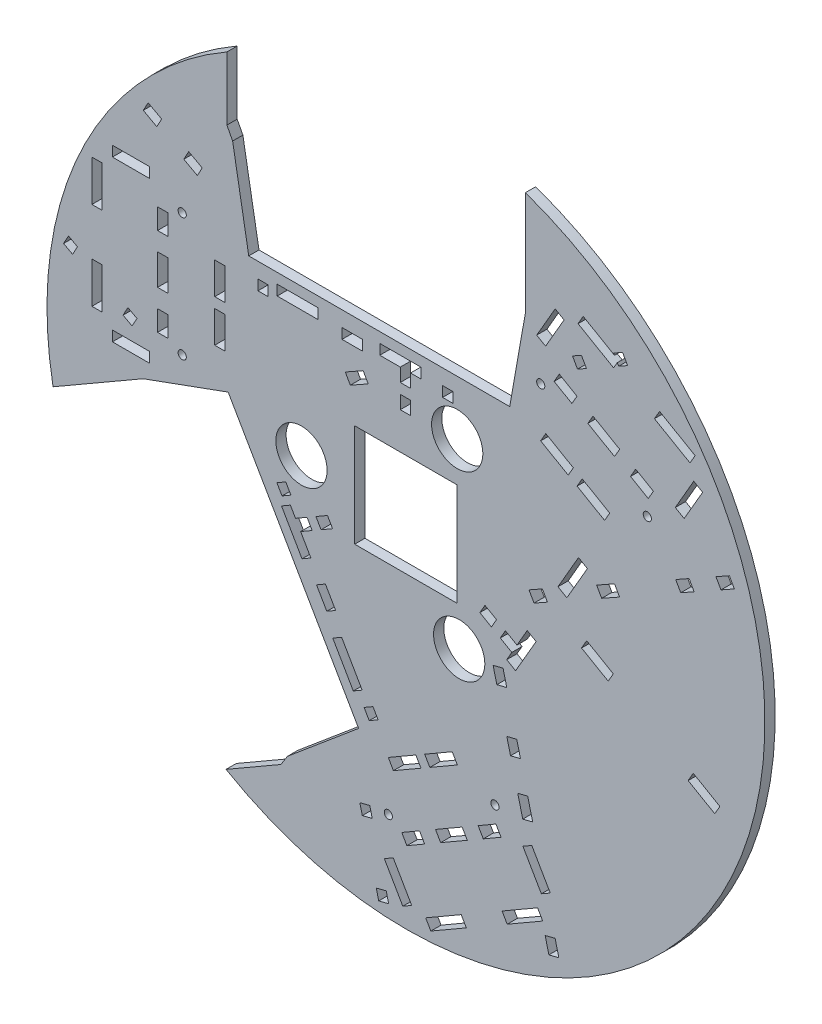
from build123d import *

# Parameters (mm, degrees)
ESQUISSE1_R                   = 175
BOSS_EXTRU_1_DEPTH            = 5
ESQUISSE2_W                   = 18
ESQUISSE2_H                   = 5
ESQUISSE2_W_2                 = 5
ESQUISSE2_H_2                 = 20
ESQUISSE2_H_3                 = 10
ESQUISSE2_H_4                 = 15
ESQUISSE2_H_5                 = 15.5
ESQUISSE2_W_3                 = 20
ESQUISSE2_H_6                 = 6.5
ENL_V_MAT_EXTRU_1_DEPTH       = 5
ESQUISSE6_R                   = 12.5
ESQUISSE6_W                   = 50
ESQUISSE6_H                   = 50
ENL_V_MAT_EXTRU_6_DEPTH       = 5
TROUS_DE_CENTRAGE_4_0MM1_D    = 4
HOLES_CATCHERS_OF_GLASS_DEPTH = 10
HOLES_BOARDS_SERVO_DEPTH      = 10
ESQUISSE11_W                  = 5
ESQUISSE11_H                  = 5
ESQUISSE11_W_2                = 10
ENL_V_MAT_EXTRU_7_DEPTH       = 5


with BuildPart() as part:
    # Esquisse1 → Boss.-Extru.1 (new body)
    with BuildSketch(Plane.XY):
        with Locations((148.080426897, -12.110171348)):
            Circle(ESQUISSE1_R)
    extrude(amount=BOSS_EXTRU_1_DEPTH)

    # Esquisse2 → Enlèv. mat.-Extru.1 (cut)
    with BuildSketch(Plane.XY.offset(5)):
        Polygon((135.311788567, 53.777441362), (135.311788567, 48.777441362), (145.311788567, 48.777441362), (145.311788567, 42.277441362), (150.311788567, 42.277441362), (150.311788567, 48.777441362), (155.311788567, 48.777441362), (155.311788567, 53.777441362), align=None)
        with Locations((14, 69.777441362)):
            Rectangle(ESQUISSE2_W, ESQUISSE2_H)
        with Locations((-2.5, 52.277441362)):
            Rectangle(ESQUISSE2_W_2, ESQUISSE2_H_2)
        with Locations((-2.5, 9.277441362)):
            Rectangle(ESQUISSE2_W_2, ESQUISSE2_H_2)
        with Locations((14, -8.222558638)):
            Rectangle(ESQUISSE2_W, ESQUISSE2_H)
        with Locations((29.5, 9.277441362)):
            Rectangle(ESQUISSE2_W_2, ESQUISSE2_H_3)
        with Locations((29.5, 30.777441362)):
            Rectangle(ESQUISSE2_W_2, ESQUISSE2_H_4)
        with Locations((29.5, 52.277441362)):
            Rectangle(ESQUISSE2_W_2, ESQUISSE2_H_3)
        with Locations((57.36, 41.027441362)):
            Rectangle(ESQUISSE2_W_2, ESQUISSE2_H_5)
        with Locations((57.36, 20.527441362)):
            Rectangle(ESQUISSE2_W_2, ESQUISSE2_H_5)
        with Locations((95.311788567, 51.277441362)):
            Rectangle(ESQUISSE2_W_3, ESQUISSE2_H)
        with Locations((147.811788567, 34.027441362)):
            Rectangle(ESQUISSE2_W_2, ESQUISSE2_H_6)
        Polygon((292.702456717, 69.607306773), (283.702456717, 54.018849505), (279.372329698, 56.518849505), (288.372329698, 72.107306773), align=None)
        Polygon((289.042202679, 83.267560811), (286.542202679, 78.937433792), (269.221694603, 88.937433792), (271.721694603, 93.267560811), align=None)
        Polygon((251.803110316, 104.767560811), (249.303110316, 100.437433792), (231.982602241, 110.437433792), (234.482602241, 114.767560811), align=None)
        Polygon((225.152475222, 108.607306773), (216.152475222, 93.018849505), (211.822348203, 95.518849505), (220.822348203, 111.107306773), align=None)
        Polygon((231.472983297, 79.55474789), (228.972983297, 75.224620871), (220.31272926, 80.224620871), (222.81272926, 84.55474789), align=None)
        Polygon((252.257592988, 67.55474789), (249.757592988, 63.224620871), (236.767211932, 70.724620871), (239.267211932, 75.05474789), align=None)
        Polygon((268.71207566, 58.05474789), (266.21207566, 53.724620871), (257.551821622, 58.724620871), (260.051821622, 63.05474789), align=None)
        Polygon((247.420859728, 38.17728014), (244.920859728, 33.847153121), (231.497465969, 41.597153121), (233.997465969, 45.92728014), align=None)
        Polygon((229.66733895, 48.42728014), (227.16733895, 44.097153121), (213.743945192, 51.847153121), (216.243945192, 56.17728014), align=None)
        Polygon((211.525092463, -33.996012539), (207.194965444, -31.496012539), (202.194965444, -40.156266577), (196.56580032, -36.906266577), (194.06580032, -41.236393596), (199.694965444, -44.486393596), (197.194965444, -48.816520615), (201.525092463, -51.316520615), align=None)
        Polygon((236.525092463, 9.30525765), (226.525092463, -8.015250425), (222.194965444, -5.515250425), (232.194965444, 11.80525765), align=None)
        Polygon((192.235673301, -34.406266577), (189.735673301, -38.736393596), (184.106508176, -35.486393596), (186.606508176, -31.156266577), align=None)
        Polygon((146.538823973, -178.215262181), (137.538823973, -162.626804912), (141.868950992, -160.126804912), (150.868950992, -175.715262181), align=None)
        Polygon((160.199078011, -181.875516218), (157.699078011, -177.545389199), (175.019586086, -167.545389199), (177.519586086, -171.875516218), align=None)
        Polygon((197.438170373, -160.375516218), (194.938170373, -156.045389199), (212.258678449, -146.045389199), (214.758678449, -150.375516218), align=None)
        Polygon((214.088805468, -139.215262181), (205.088805468, -123.626804912), (209.418932487, -121.126804912), (218.418932487, -136.715262181), align=None)
        Polygon((185.768297392, -130.162703297), (183.268297392, -125.832576278), (191.92855143, -120.832576278), (194.42855143, -125.162703297), align=None)
        Polygon((164.983687701, -142.162703297), (162.483687701, -137.832576278), (175.474068758, -130.332576278), (177.974068758, -134.662703297), align=None)
        Polygon((148.52920503, -151.662703297), (146.02920503, -147.332576278), (154.689459067, -142.332576278), (157.189459067, -146.662703297), align=None)
        Polygon((141.960420962, -123.285235548), (139.460420962, -118.955108529), (152.88381472, -111.205108529), (155.38381472, -115.535235548), align=None)
        Polygon((159.713941739, -113.035235548), (157.213941739, -108.705108529), (170.637335498, -100.955108529), (173.137335498, -105.285235548), align=None)
        Polygon((97.404399659, -56.111942869), (101.734526678, -53.611942869), (96.734526678, -44.951688831), (102.363691803, -41.701688831), (99.863691803, -37.371561812), (94.234526678, -40.621561812), (91.734526678, -36.291434793), (87.404399659, -38.791434793), align=None)
        Polygon((122.404399659, -99.413213058), (112.404399659, -82.092704982), (116.734526678, -79.592704982), (126.734526678, -96.913213058), align=None)
        Polygon((106.693818822, -39.201688831), (104.193818822, -34.871561812), (109.822983946, -31.621561812), (112.322983946, -35.951688831), align=None)
    extrude(amount=-ENL_V_MAT_EXTRU_1_DEPTH, mode=Mode.SUBTRACT)

    # Esquisse6 → Enlèv. mat.-Extru.6 (cut)
    with BuildSketch(Plane.XY.offset(5)):
        with Locations((173.06, 32.277441362)):
            Circle(ESQUISSE6_R)
        with Locations((174.031440566, -55.936922587)):
            Circle(ESQUISSE6_R)
        with Locations((97.149840124, -12.671032821)):
            Circle(ESQUISSE6_R)
        Polygon((206.321253746, 102.221853729), (206.321253746, 185.563712918), (60.797190046, 185.563712918), (60.797190046, 108.682370842), (63.584787187, 103.348250546), (71.443823398, 58.777441362), (198.660831685, 58.777441362), align=None)
        with Locations((148.080426897, -12.110171348)):
            Rectangle(ESQUISSE6_W, ESQUISSE6_H)
        Polygon((19.945575289, -18.838148298), (-52.230591968, -60.509077893), (20.531439882, -186.536613919), (87.112635197, -148.095942881), (90.338320311, -143.014752793), (125.008255225, -113.923223194), (61.399751081, -3.750062223), align=None)
        Polygon((236.171367804, -21.307411432), (249.16174886, -28.807411432), (246.66174886, -33.137538451), (233.671367804, -25.637538451), align=None)
        Polygon((288.132892031, -51.307411432), (301.123273088, -58.807411432), (298.623273088, -63.137538451), (285.632892031, -55.637538451), align=None)
    extrude(amount=-ENL_V_MAT_EXTRU_6_DEPTH, mode=Mode.SUBTRACT)

    # Trous de centrage Ø4.0mm1 (through all)
    with Locations(Plane(origin=(148.080426897, -12.110171348, -78), x_dir=(1, 0, 0), z_dir=(0, 0, -1))):
        with Locations((65.70121345, -88.022614393), (117.662737677, -58.022614393), (-109.080426897, -72.887612711), (-109.080426897, -12.887612711), (-8.58231078, 130.910227103), (43.379213447, 100.910227103)):
            Hole(TROUS_DE_CENTRAGE_4_0MM1_D / 2)

    # Esquisse9 → Holes catchers of glass (cut)
    with BuildSketch(Plane.XY.offset(5)):
        Polygon((301.647255965, 32.874727734), (299.200467122, 37.235143352), (305.741090548, 40.905326617), (308.187879391, 36.544910999), align=None)
        Polygon((282.025385687, 21.864177939), (279.578596844, 26.224593557), (286.11922027, 29.894776822), (288.566009113, 25.534361204), align=None)
        Polygon((252.208863696, 5.133035829), (249.762074852, 9.493451446), (241.041243617, 4.599873759), (243.488032461, 0.239458142), align=None)
        Polygon((214.608404145, -10.232560209), (217.055192988, -14.592975826), (210.514569562, -18.263159091), (208.067780719, -13.902743474), align=None)
        Polygon((256.127471573, 104.799683271), (251.767055956, 102.352894427), (249.320267112, 106.713310045), (253.68068273, 109.160098888), align=None)
        Polygon((236.069559733, 93.544454591), (231.709144116, 91.097665748), (229.262355272, 95.458081365), (233.62277089, 97.904870209), align=None)
        Polygon((129.675418669, 33.842806815), (120.954587434, 28.949229128), (118.507798591, 33.309644745), (127.228629826, 38.203222432), align=None)
        Polygon((-16.43844555, 23.279140051), (-12.045948181, 20.890423478), (-14.434664754, 16.49792611), (-18.827162123, 18.886642683), align=None)
        Polygon((12.552037084, 7.51361067), (16.944534453, 5.124894098), (14.55581788, 0.732396729), (10.163320511, 3.121113302), align=None)
        Polygon((22.412737241, 98.907081949), (29.001483294, 95.32400709), (26.612766722, 90.931509721), (20.024020668, 94.514584581), align=None)
        Polygon((42.178975401, 88.157857372), (48.767721454, 84.574782512), (46.379004881, 80.182285143), (39.790258828, 83.765360003), align=None)
        Polygon((126.799616111, -149.834276272), (125.585690653, -144.983875775), (130.43609115, -143.769950316), (131.650016608, -148.620350813), align=None)
        Polygon((134.811524138, -181.846919552), (133.597598679, -176.996519055), (138.447999176, -175.782593596), (139.661924635, -180.632994093), align=None)
        Polygon((190.561972498, -54.501375823), (195.412372995, -53.287450364), (197.233261183, -60.56305111), (192.382860686, -61.776976568), align=None)
        Polygon((202.088963017, -79.964653097), (197.23856252, -81.178578556), (199.059450708, -88.454179302), (203.909851205, -87.240253843), align=None)
        Polygon((222.604303267, -161.936421496), (217.75390277, -163.150346955), (215.933014582, -155.874746209), (220.783415079, -154.660820751), align=None)
    extrude(amount=-HOLES_CATCHERS_OF_GLASS_DEPTH, mode=Mode.SUBTRACT)

    # Esquisse10 → Holes boards servo (cut)
    with BuildSketch(Plane.XY.offset(5)):
        Polygon((89.496120404, -27.614401399), (91.996120404, -31.944528418), (87.66720686, -34.443827818), (85.16720686, -30.113700799), align=None)
    extrude(amount=-HOLES_BOARDS_SERVO_DEPTH, mode=Mode.SUBTRACT)

    # Esquisse11 → Enlèv. mat.-Extru.7 (cut)
    with BuildSketch(Plane.XY.offset(5)):
        Polygon((109.482860628, -72.232450944), (104.482860628, -63.572196906), (108.812987647, -61.072196906), (113.812987647, -69.732450944), align=None)
        Polygon((130.165993385, -108.056687739), (134.496120404, -105.556687739), (131.996120404, -101.22656072), (127.665993385, -103.72656072), align=None)
        Polygon((207.430235035, -101.306415284), (209.858085952, -111.007216278), (205.007685455, -112.221141737), (202.579834538, -102.520340743), align=None)
        with Locations((168.425291316, 48.777441362)):
            Rectangle(ESQUISSE11_W, ESQUISSE11_H)
        with Locations((121.925291316, 48.777441362)):
            Rectangle(ESQUISSE11_W_2, ESQUISSE11_H)
        with Locations((78.425291316, 48.777441362)):
            Rectangle(ESQUISSE11_W, ESQUISSE11_H)
    extrude(amount=-ENL_V_MAT_EXTRU_7_DEPTH, mode=Mode.SUBTRACT)


solid = part.part
